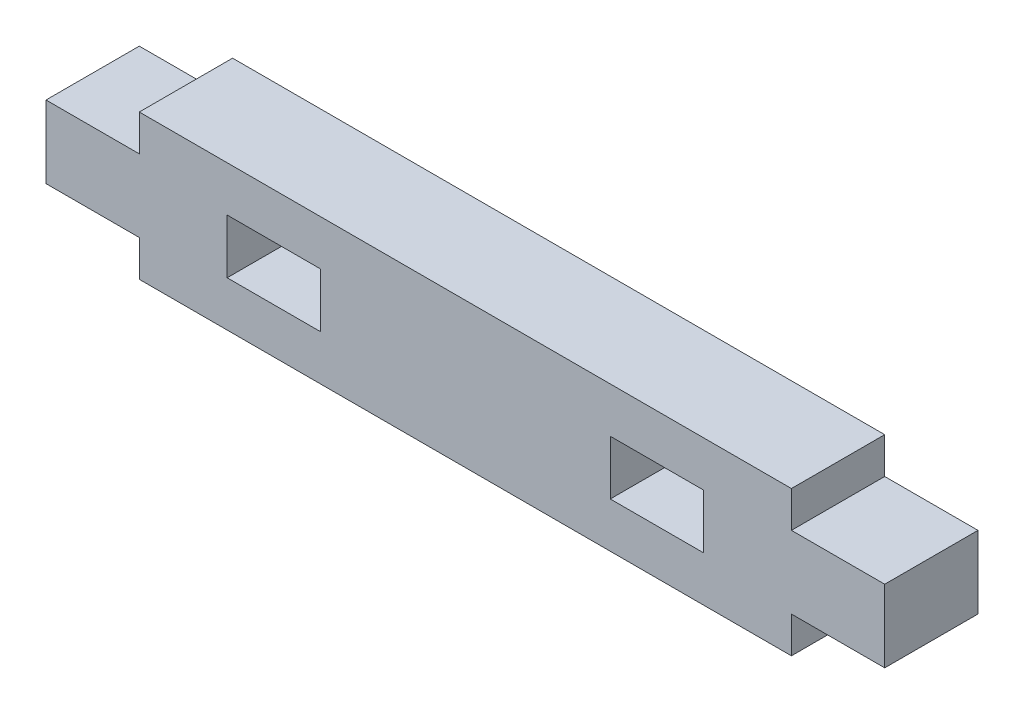
from build123d import *

# Parameters (mm, degrees)
BOSS_EXTRUDE1_DEPTH = 5.15
SKETCH2_W           = 5.15
SKETCH2_H           = 3
CUT_EXTRUDE1_DEPTH  = 26.028883315


with BuildPart() as part:
    # Sketch1 → Boss-Extrude1 (new body)
    with BuildSketch(Plane.XY):
        Polygon((-18, 0), (0, 0), (18, 0), (18, 2), (23.15, 2), (23.15, 6), (18, 6), (18, 8), (-18, 8), (-18, 6), (-23.15, 6), (-23.15, 2), (-18, 2), align=None)
    extrude(amount=BOSS_EXTRUDE1_DEPTH)

    # Sketch2 → Cut-Extrude1 (cut, through all)
    with BuildSketch(Plane.XY.offset(5.15)):
        with Locations((10.575, 4)):
            Rectangle(SKETCH2_W, SKETCH2_H)
        with Locations((-10.575, 4)):
            Rectangle(SKETCH2_W, SKETCH2_H)
    extrude(amount=-CUT_EXTRUDE1_DEPTH, mode=Mode.SUBTRACT)


solid = part.part
